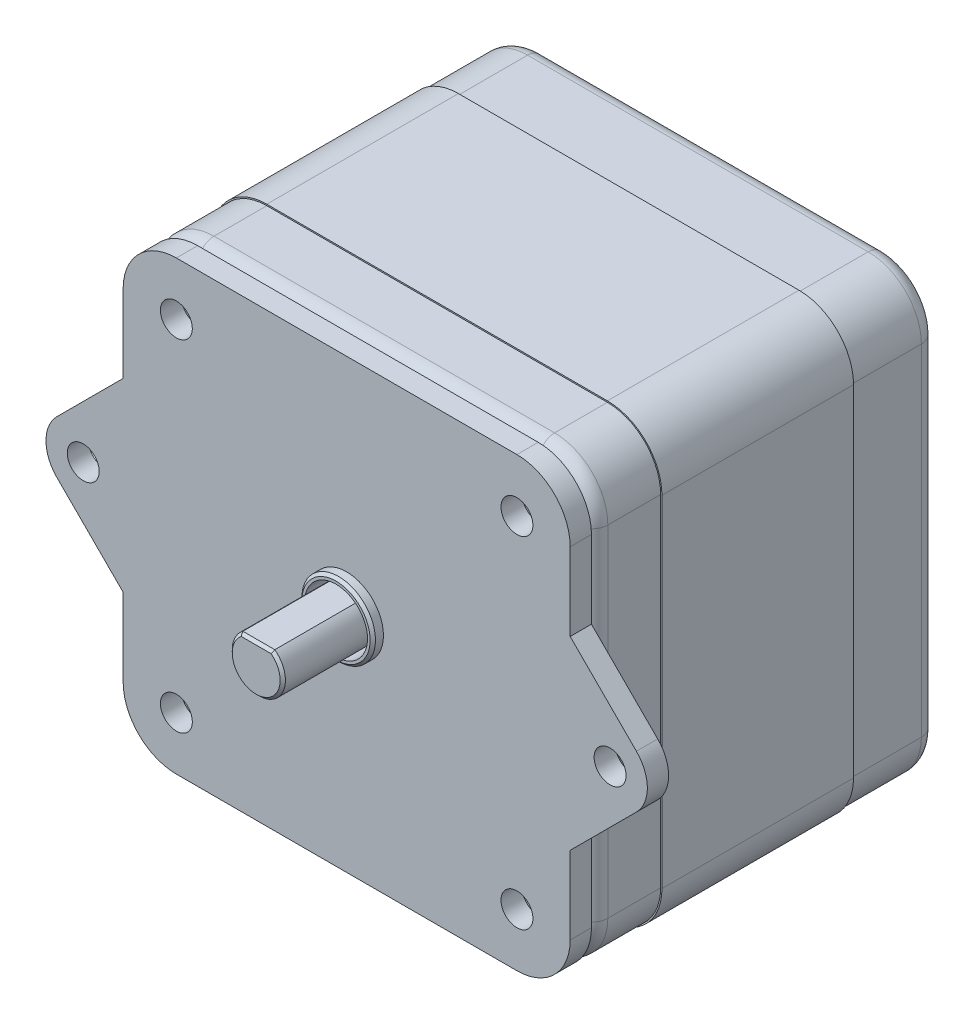
from build123d import *

# Parameters (mm, degrees)
BOSS_EXTRUDE1_DEPTH = 34.5
SKETCH3_R           = 1.5
BOSS_EXTRUDE2_DEPTH = 2
BOSS_EXTRUDE3_DEPTH = 8.5
SKETCH5_R           = 3.457531881
SKETCH5_R_2         = 2.957531881
BOSS_EXTRUDE4_DEPTH = 1
CUT_EXTRUDE1_START  = -10
SKETCH6_R           = 2.957531881
CUT_EXTRUDE1_DEPTH  = 10
CHAMFER1_SIZE       = 0.25
CUT_EXTRUDE2_DEPTH  = 0.125
FILLET1_R           = 1.5
SKETCH8_R           = 1.5
CUT_EXTRUDE3_DEPTH  = 2
BOSS_EXTRUDE5_START = 0.5
SKETCH9_R           = 2.957531881
SKETCH9_R_2         = 2.75
BOSS_EXTRUDE5_DEPTH = 0.5
CUT_EXTRUDE4_DEPTH  = 1
BOSS_EXTRUDE6_START = -18
BOSS_EXTRUDE6_DEPTH = 18


with BuildPart() as part:
    # Sketch2 → Boss-Extrude1 (new body)
    with BuildSketch(Plane.XY):
        with BuildLine():
            Line((-21, 16), (-21, -16))
            ThreePointArc((-21, -16), (-19.535533906, -19.535533906), (-16, -21))
            Line((-16, -21), (16, -21))
            ThreePointArc((16, -21), (19.535533906, -19.535533906), (21, -16))
            Line((21, -16), (21, 16))
            ThreePointArc((21, 16), (19.535533906, 19.535533906), (16, 21))
            Line((16, 21), (-16, 21))
            ThreePointArc((-16, 21), (-19.535533906, 19.535533906), (-21, 16))
        make_face()
    extrude(amount=-BOSS_EXTRUDE1_DEPTH)

    # Sketch3 → Boss-Extrude2 (add)
    with BuildSketch(Plane.XY):
        with BuildLine():
            Line((-27.224873734, 2.474873734), (-21, 8.699747468))
            Line((-21, 8.699747468), (-21, 16))
            ThreePointArc((-21, 16), (-19.535533906, 19.535533906), (-16, 21))
            Line((-16, 21), (16, 21))
            ThreePointArc((16, 21), (19.535533906, 19.535533906), (21, 16))
            Line((21, 16), (21, 8.699747468))
            Line((21, 8.699747468), (27.224873734, 2.474873734))
            ThreePointArc((27.224873734, 2.474873734), (28.25, 0), (27.224873734, -2.474873734))
            Line((27.224873734, -2.474873734), (21, -8.699747468))
            Line((21, -8.699747468), (21, -16))
            ThreePointArc((21, -16), (19.535533906, -19.535533906), (16, -21))
            Line((16, -21), (-16, -21))
            ThreePointArc((-16, -21), (-19.535533906, -19.535533906), (-21, -16))
            Line((-21, -16), (-21, -8.699747468))
            Line((-21, -8.699747468), (-27.224873734, -2.474873734))
            ThreePointArc((-27.224873734, -2.474873734), (-28.25, 0), (-27.224873734, 2.474873734))
        make_face()
        with Locations((-24.75, 0)):
            Circle(SKETCH3_R, mode=Mode.SUBTRACT)
        with Locations((24.75, 0)):
            Circle(SKETCH3_R, mode=Mode.SUBTRACT)
    extrude(amount=-BOSS_EXTRUDE2_DEPTH)

    # Sketch4 → Boss-Extrude3 (add)
    with BuildSketch(Plane.XY):
        with BuildLine():
            Line((-1.5, 2), (1.5, 2))
            ThreePointArc((1.5, 2), (0, -2.5), (-1.5, 2))
        make_face()
    extrude(amount=BOSS_EXTRUDE3_DEPTH)

    # Sketch5 → Boss-Extrude4 (add)
    with BuildSketch(Plane.XY):
        Circle(SKETCH5_R)
        Circle(SKETCH5_R_2, mode=Mode.SUBTRACT)
    extrude(amount=BOSS_EXTRUDE4_DEPTH)

    # Sketch6 → Cut-Extrude1 (cut)
    with BuildSketch(Plane.XY.offset(CUT_EXTRUDE1_START)):
        Circle(SKETCH6_R)
        with BuildLine():
            Line((1.5, 2), (-1.5, 2))
            ThreePointArc((-1.5, 2), (0, -2.5), (1.5, 2))
        make_face(mode=Mode.SUBTRACT)
    extrude(amount=CUT_EXTRUDE1_DEPTH, mode=Mode.SUBTRACT)

    # Chamfer1
    chamfer1_edges = [part.edges().sort_by_distance(p)[0] for p in [
        (0, -2.5, 8.5),
        (0, 2, 8.5),
        (-3.457531881, 0, 1),
    ]]
    chamfer(chamfer1_edges, length=CHAMFER1_SIZE)

    # Sketch7 → Cut-Extrude2 (cut)
    with BuildSketch(Plane(origin=(0, 0, -2), x_dir=(-1, 0, 0), z_dir=(0, 0, -1))):
        with BuildLine():
            Line((-16, 21), (16, 21))
            ThreePointArc((16, 21), (19.535533906, 19.535533906), (21, 16))
            Line((21, 16), (21, -16))
            ThreePointArc((21, -16), (19.535533906, -19.535533906), (16, -21))
            Line((16, -21), (-16, -21))
            ThreePointArc((-16, -21), (-19.535533906, -19.535533906), (-21, -16))
            Line((-21, -16), (-21, 16))
            ThreePointArc((-21, 16), (-19.535533906, 19.535533906), (-16, 21))
        make_face()
        with BuildLine():
            Line((-16, 20), (16, 20))
            ThreePointArc((16, 20), (18.828427125, 18.828427125), (20, 16))
            Line((20, 16), (20, -16))
            ThreePointArc((20, -16), (18.828427125, -18.828427125), (16, -20))
            Line((16, -20), (-16, -20))
            ThreePointArc((-16, -20), (-18.828427125, -18.828427125), (-20, -16))
            Line((-20, -16), (-20, 16))
            ThreePointArc((-20, 16), (-18.828427125, 18.828427125), (-16, 20))
        make_face(mode=Mode.SUBTRACT)
    extrude(amount=CUT_EXTRUDE2_DEPTH, mode=Mode.SUBTRACT)

    # Fillet1
    # the kernel refuses this fillet: 1.5 mm, written as the material it takes off along each edge
    with BuildSketch(Plane(origin=(-16, -16, -34.5), x_dir=(-1, 0, 0), z_dir=(0, 1, 0))) as fillet1_piece_1:
        with BuildLine():
            CenterArc((5 - FILLET1_R, FILLET1_R), FILLET1_R, 270, 90)
            Line((5 - FILLET1_R, 0), (5 - FILLET1_R, -FILLET1_R * 0.02))
            Line((5 - FILLET1_R, -FILLET1_R * 0.02), (5 + FILLET1_R * 0.02, -FILLET1_R * 0.02))
            Line((5 + FILLET1_R * 0.02, -FILLET1_R * 0.02), (5 + FILLET1_R * 0.02, FILLET1_R))
            Line((5 + FILLET1_R * 0.02, FILLET1_R), (5, FILLET1_R))
        make_face()
    revolve(axis=Axis((-16, -16, -34.5), (0, 0, 1)), revolution_arc=90, mode=Mode.SUBTRACT)
    with BuildSketch(Plane(origin=(-16, -21, -34.5), x_dir=(0, 0, 1), z_dir=(1, 0, 0)), Plane(origin=(21, -16, -34.5), x_dir=(0, 0, 1), z_dir=(0, 1, 0)), Plane(origin=(16, 21, -34.5), x_dir=(0, 0, 1), z_dir=(-1, 0, 0)), Plane(origin=(-21, 16, -34.5), x_dir=(0, 0, 1), z_dir=(0, -1, 0))) as fillet1_piece_2:
        with BuildLine():
            CenterArc((FILLET1_R, -FILLET1_R), FILLET1_R, 90, 90)
            Line((0, -FILLET1_R), (-FILLET1_R * 0.02, -FILLET1_R))
            Line((-FILLET1_R * 0.02, -FILLET1_R), (-FILLET1_R * 0.02, FILLET1_R * 0.02))
            Line((-FILLET1_R * 0.02, FILLET1_R * 0.02), (FILLET1_R, FILLET1_R * 0.02))
            Line((FILLET1_R, FILLET1_R * 0.02), (FILLET1_R, 0))
        make_face()
    extrude(amount=32, mode=Mode.SUBTRACT)
    with BuildSketch(Plane(origin=(16, 16, -2.125), x_dir=(1, 0, 0), z_dir=(0, -1, 0))) as fillet1_piece_3:
        with BuildLine():
            CenterArc((3.5, -1.414213562), FILLET1_R, 0, 70.528779366)
            Line((5, -1.414213562), (5.03, -1.414213562))
            Line((5.03, -1.414213562), (5.03, 0))
            Line((5.03, 0), (5, 0.03))
            ThreePointArc((5, 0.03), (4.5, 0.03), (4.01, 0.028284271))
            Line((4.01, 0.028284271), (4, 0))
        make_face()
    revolve(axis=Axis((16, 16, -2.125), (0, 0, 1)), revolution_arc=90, mode=Mode.SUBTRACT)
    with BuildSketch(Plane(origin=(21, -16, -2.125), x_dir=(-1, 0, 0), z_dir=(0, 1, 0)), Plane(origin=(-16, -21, -2.125), x_dir=(0, 1, 0), z_dir=(1, 0, 0)), Plane(origin=(-21, 16, -2.125), x_dir=(1, 0, 0), z_dir=(0, -1, 0)), Plane(origin=(16, 21, -2.125), x_dir=(0, -1, 0), z_dir=(-1, 0, 0))) as fillet1_piece_4:
        with BuildLine():
            CenterArc((1.5, -1.414213562), FILLET1_R, 109.471220634, 70.528779366)
            Line((0, -1.414213562), (-0.03, -1.414213562))
            Line((-0.03, -1.414213562), (-0.03, 0))
            Line((-0.03, 0), (0, 0.03))
            ThreePointArc((0, 0.03), (0.5, 0.03), (0.99, 0.028284271))
            Line((0.99, 0.028284271), (1, 0))
        make_face()
    extrude(amount=32, mode=Mode.SUBTRACT)
    with BuildSketch(Plane(origin=(16, -16, -2.125), x_dir=(0, -1, 0), z_dir=(-1, 0, 0))) as fillet1_piece_5:
        with BuildLine():
            CenterArc((3.5, -1.414213562), FILLET1_R, 0, 70.528779366)
            Line((5, -1.414213562), (5.03, -1.414213562))
            Line((5.03, -1.414213562), (5.03, 0))
            Line((5.03, 0), (5, 0.03))
            ThreePointArc((5, 0.03), (4.5, 0.03), (4.01, 0.028284271))
            Line((4.01, 0.028284271), (4, 0))
        make_face()
    revolve(axis=Axis((16, -16, -2.125), (0, 0, 1)), revolution_arc=90, mode=Mode.SUBTRACT)
    with BuildSketch(Plane(origin=(-16, -16, -2.125), x_dir=(-1, 0, 0), z_dir=(0, 1, 0))) as fillet1_piece_6:
        with BuildLine():
            CenterArc((3.5, -1.414213562), FILLET1_R, 0, 70.528779366)
            Line((5, -1.414213562), (5.03, -1.414213562))
            Line((5.03, -1.414213562), (5.03, 0))
            Line((5.03, 0), (5, 0.03))
            ThreePointArc((5, 0.03), (4.5, 0.03), (4.01, 0.028284271))
            Line((4.01, 0.028284271), (4, 0))
        make_face()
    revolve(axis=Axis((-16, -16, -2.125), (0, 0, 1)), revolution_arc=90, mode=Mode.SUBTRACT)
    with BuildSketch(Plane(origin=(-16, 16, -2.125), x_dir=(0, 1, 0), z_dir=(1, 0, 0))) as fillet1_piece_7:
        with BuildLine():
            CenterArc((3.5, -1.414213562), FILLET1_R, 0, 70.528779366)
            Line((5, -1.414213562), (5.03, -1.414213562))
            Line((5.03, -1.414213562), (5.03, 0))
            Line((5.03, 0), (5, 0.03))
            ThreePointArc((5, 0.03), (4.5, 0.03), (4.01, 0.028284271))
            Line((4.01, 0.028284271), (4, 0))
        make_face()
    revolve(axis=Axis((-16, 16, -2.125), (0, 0, 1)), revolution_arc=90, mode=Mode.SUBTRACT)
    with BuildSketch(Plane(origin=(16, -16, -34.5), x_dir=(0, -1, 0), z_dir=(-1, 0, 0))) as fillet1_piece_8:
        with BuildLine():
            CenterArc((5 - FILLET1_R, FILLET1_R), FILLET1_R, 270, 90)
            Line((5 - FILLET1_R, 0), (5 - FILLET1_R, -FILLET1_R * 0.02))
            Line((5 - FILLET1_R, -FILLET1_R * 0.02), (5 + FILLET1_R * 0.02, -FILLET1_R * 0.02))
            Line((5 + FILLET1_R * 0.02, -FILLET1_R * 0.02), (5 + FILLET1_R * 0.02, FILLET1_R))
            Line((5 + FILLET1_R * 0.02, FILLET1_R), (5, FILLET1_R))
        make_face()
    revolve(axis=Axis((16, -16, -34.5), (0, 0, 1)), revolution_arc=90, mode=Mode.SUBTRACT)
    with BuildSketch(Plane(origin=(16, 16, -34.5), x_dir=(1, 0, 0), z_dir=(0, -1, 0))) as fillet1_piece_9:
        with BuildLine():
            CenterArc((5 - FILLET1_R, FILLET1_R), FILLET1_R, 270, 90)
            Line((5 - FILLET1_R, 0), (5 - FILLET1_R, -FILLET1_R * 0.02))
            Line((5 - FILLET1_R, -FILLET1_R * 0.02), (5 + FILLET1_R * 0.02, -FILLET1_R * 0.02))
            Line((5 + FILLET1_R * 0.02, -FILLET1_R * 0.02), (5 + FILLET1_R * 0.02, FILLET1_R))
            Line((5 + FILLET1_R * 0.02, FILLET1_R), (5, FILLET1_R))
        make_face()
    revolve(axis=Axis((16, 16, -34.5), (0, 0, 1)), revolution_arc=90, mode=Mode.SUBTRACT)
    with BuildSketch(Plane(origin=(-16, 16, -34.5), x_dir=(0, 1, 0), z_dir=(1, 0, 0))) as fillet1_piece_10:
        with BuildLine():
            CenterArc((5 - FILLET1_R, FILLET1_R), FILLET1_R, 270, 90)
            Line((5 - FILLET1_R, 0), (5 - FILLET1_R, -FILLET1_R * 0.02))
            Line((5 - FILLET1_R, -FILLET1_R * 0.02), (5 + FILLET1_R * 0.02, -FILLET1_R * 0.02))
            Line((5 + FILLET1_R * 0.02, -FILLET1_R * 0.02), (5 + FILLET1_R * 0.02, FILLET1_R))
            Line((5 + FILLET1_R * 0.02, FILLET1_R), (5, FILLET1_R))
        make_face()
    revolve(axis=Axis((-16, 16, -34.5), (0, 0, 1)), revolution_arc=90, mode=Mode.SUBTRACT)

    # Sketch8 → Cut-Extrude3 (cut)
    with BuildSketch(Plane.XY):
        with Locations((-16, 16)):
            Circle(SKETCH8_R)
        with Locations(Location((16, 16, 0), (0, 0, 180))):
            Circle(SKETCH8_R)
        with Locations((16, -16)):
            Circle(SKETCH8_R)
        with Locations(Location((-16, -16, 0), (0, 0, 180))):
            Circle(SKETCH8_R)
    extrude(amount=-CUT_EXTRUDE3_DEPTH, mode=Mode.SUBTRACT)

    # Sketch9 → Boss-Extrude5 (add)
    with BuildSketch(Plane(origin=(0, 0, -34.5), x_dir=(-1, 0, 0), z_dir=(0, 0, -1)).offset(BOSS_EXTRUDE5_START)):
        with Locations(Location((0, 0, 0), (0, 0, 180))):
            Circle(SKETCH9_R)
        with Locations(Location((-16, 16, 0), (0, 0, 180))):
            Circle(SKETCH9_R_2)
        with Locations(Location((16, 16, 0), (0, 0, 180))):
            Circle(SKETCH9_R_2)
        with Locations(Location((16, -16, 0), (0, 0, 180))):
            Circle(SKETCH9_R_2)
        with Locations(Location((-16, -16, 0), (0, 0, 180))):
            Circle(SKETCH9_R_2)
    extrude(amount=-BOSS_EXTRUDE5_DEPTH)

    # Sketch10 → Cut-Extrude4 (cut)
    with BuildSketch(Plane(origin=(0, 0, -35), x_dir=(-1, 0, 0), z_dir=(0, 0, -1))):
        Polygon((-15.5, 14.5), (-15.5, 15.5), (-14.5, 15.5), (-14.5, 16.5), (-15.5, 16.5), (-15.5, 17.5), (-16.5, 17.5), (-16.5, 16.5), (-17.5, 16.5), (-17.5, 15.5), (-16.5, 15.5), (-16.5, 14.5), align=None)
        Polygon((15.5, 16.5), (15.5, 17.5), (16.5, 17.5), (16.5, 16.5), (17.5, 16.5), (17.5, 15.5), (16.5, 15.5), (16.5, 14.5), (15.5, 14.5), (15.5, 15.5), (14.5, 15.5), (14.5, 16.5), align=None)
        Polygon((15.5, -14.5), (15.5, -15.5), (14.5, -15.5), (14.5, -16.5), (15.5, -16.5), (15.5, -17.5), (16.5, -17.5), (16.5, -16.5), (17.5, -16.5), (17.5, -15.5), (16.5, -15.5), (16.5, -14.5), align=None)
        Polygon((-15.5, -16.5), (-15.5, -17.5), (-16.5, -17.5), (-16.5, -16.5), (-17.5, -16.5), (-17.5, -15.5), (-16.5, -15.5), (-16.5, -14.5), (-15.5, -14.5), (-15.5, -15.5), (-14.5, -15.5), (-14.5, -16.5), align=None)
    extrude(amount=-CUT_EXTRUDE4_DEPTH, mode=Mode.SUBTRACT)

    # Sketch11 → Boss-Extrude6 (add)
    with BuildSketch(Plane(origin=(0, 0, -26.5), x_dir=(-1, 0, 0), z_dir=(0, 0, -1)).offset(BOSS_EXTRUDE6_START)):
        with BuildLine():
            Line((-21.125, -16), (-21.125, 16))
            ThreePointArc((-21.125, 16), (-19.623922254, 19.623922254), (-16, 21.125))
            Line((-16, 21.125), (16, 21.125))
            ThreePointArc((16, 21.125), (19.623922254, 19.623922254), (21.125, 16))
            Line((21.125, 16), (21.125, -16))
            ThreePointArc((21.125, -16), (19.623922254, -19.623922254), (16, -21.125))
            Line((16, -21.125), (-16, -21.125))
            ThreePointArc((-16, -21.125), (-19.623922254, -19.623922254), (-21.125, -16))
        make_face()
        with BuildLine():
            Line((-16, 21), (16, 21))
            ThreePointArc((16, 21), (19.535533906, 19.535533906), (21, 16))
            Line((21, 16), (21, -16))
            ThreePointArc((21, -16), (19.535533906, -19.535533906), (16, -21))
            Line((16, -21), (-16, -21))
            ThreePointArc((-16, -21), (-19.535533906, -19.535533906), (-21, -16))
            Line((-21, -16), (-21, 16))
            ThreePointArc((-21, 16), (-19.535533906, 19.535533906), (-16, 21))
        make_face(mode=Mode.SUBTRACT)
    extrude(amount=BOSS_EXTRUDE6_DEPTH)


solid = part.part
